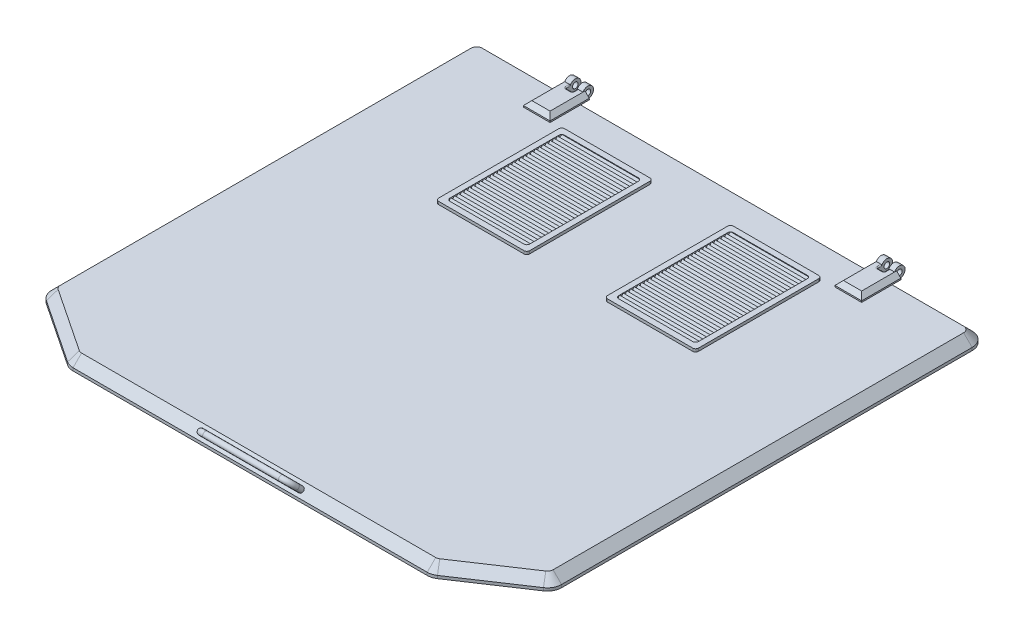
from build123d import *

# Parameters (mm, degrees)
BOSS_EXTRUDE1_DEPTH      = 30
CHAMFER1_SIZE            = 10
BOSS_EXTRUDE3_DEPTH      = 40
CHAMFER3_SIZE            = 30
SKETCH5_W                = 94.289642791
SKETCH5_H                = 138.3581249
BOSS_EXTRUDE4_DEPTH      = 20
CHAMFER4_SIZE            = 15
CHAMFER5_SIZE            = 15
SURFACE_EXTRUDE1_1_BACK  = 20
SURFACE_EXTRUDE1_1_DEPTH = 20
THICKEN1_T2              = 10
SURFACE_EXTRUDE2_2_BACK  = 20
SURFACE_EXTRUDE2_2_DEPTH = 20
THICKEN2_T2              = 10
SURFACE_EXTRUDE4_3_DEPTH = 20
THICKEN3_T2              = 10
SURFACE_EXTRUDE3_4_BACK  = 20
SURFACE_EXTRUDE3_4_DEPTH = 20
THICKEN4_T2              = 10
BOSS_EXTRUDE5_DEPTH      = 10
CUT_EXTRUDE3_DEPTH       = 60
CUT_EXTRUDE3_DEPTH_BACK  = 120
BOSS_EXTRUDE6_DEPTH      = 281.415480135
BOSS_EXTRUDE7_START      = -596.172988
BOSS_EXTRUDE7_DEPTH      = 281.415480135
SKETCH17_R               = 10
SKETCH24_W               = 24.289642791
SKETCH24_H               = 20
CUT_EXTRUDE11_DEPTH      = 25
FILLET4_R                = 4


with BuildPart() as part:
    # Sketch1 → Boss-Extrude1 (new body)
    with BuildSketch(Plane(origin=(0, 0, 0), x_dir=(1, 0, 0), z_dir=(0, 1, 0))):
        with BuildLine():
            Line((-1250.346420529, 795.394052981), (-1250.346420529, -623.902271849))
            ThreePointArc((-1250.346420529, -623.902271849), (-1247.979912504, -633.33943036), (-1241.440424453, -640.543277736))
            Line((-1241.440424453, -640.543277736), (-1030.731332227, -781.016005887))
            ThreePointArc((-1030.731332227, -781.016005887), (-1025.433011277, -783.51684053), (-1019.637328303, -784.375))
            Line((-1019.637328303, -784.375), (218.944487245, -784.375))
            ThreePointArc((218.944487245, -784.375), (224.740170219, -783.51684053), (230.03849117, -781.016005887))
            Line((230.03849117, -781.016005887), (440.747583396, -640.543277736))
            ThreePointArc((440.747583396, -640.543277736), (447.287071447, -633.33943036), (449.653579471, -623.902271849))
            Line((449.653579471, -623.902271849), (449.653579471, 795.394052981))
            ThreePointArc((449.653579471, 795.394052981), (443.795715095, 809.536188605), (429.653579471, 815.394052981))
            Line((429.653579471, 815.394052981), (-1230.346420529, 815.394052981))
            ThreePointArc((-1230.346420529, 815.394052981), (-1244.488556153, 809.536188605), (-1250.346420529, 795.394052981))
        make_face()
    extrude(amount=BOSS_EXTRUDE1_DEPTH)

    # Chamfer1
    chamfer1_edges = [part.edges().sort_by_distance(p)[0] for p in [
        (-1250.346420529, 0, -85.745890566),
        (-1247.979912504, 0, 633.33943036),
        (-1136.08587834, 0, 710.779641811),
        (-1025.433011277, 0, 783.51684053),
        (-400.346420529, 0, 784.375),
        (224.740170219, 0, 783.51684053),
        (335.393037283, 0, 710.779641811),
        (447.287071447, 0, 633.33943036),
        (449.653579471, 0, -85.745890566),
        (443.795715095, 0, -809.536188605),
        (-400.346420529, 0, -815.394052981),
        (-1244.488556153, 0, -809.536188605),
    ]]
    chamfer(chamfer1_edges, length=CHAMFER1_SIZE)

    # Sketch4 → Boss-Extrude3 (add)
    with BuildSketch(Plane(origin=(0, 30, 0), x_dir=(1, 0, 0), z_dir=(0, 1, 0))):
        with BuildLine():
            Line((-1300.346420529, 815.394052981), (-1300.346420529, -634.605947019))
            ThreePointArc((-1300.346420529, -634.605947019), (-1294.430150467, -658.198843296), (-1278.08143034, -676.208461736))
            Line((-1278.08143034, -676.208461736), (-1053.427850869, -825.977514717))
            ThreePointArc((-1053.427850869, -825.977514717), (-1040.182048492, -832.229601324), (-1025.692841058, -834.375))
            Line((-1025.692841058, -834.375), (225, -834.375))
            ThreePointArc((225, -834.375), (239.489207434, -832.229601324), (252.735009811, -825.977514717))
            Line((252.735009811, -825.977514717), (477.388589282, -676.208461736))
            ThreePointArc((477.388589282, -676.208461736), (493.73730941, -658.198843296), (499.653579471, -634.605947019))
            Line((499.653579471, -634.605947019), (499.653579471, 815.394052981))
            ThreePointArc((499.653579471, 815.394052981), (485.008918531, 850.74939204), (449.653579471, 865.394052981))
            Line((449.653579471, 865.394052981), (-1250.346420529, 865.394052981))
            ThreePointArc((-1250.346420529, 865.394052981), (-1285.701759588, 850.74939204), (-1300.346420529, 815.394052981))
        make_face()
    extrude(amount=BOSS_EXTRUDE3_DEPTH)

    # Chamfer3
    chamfer3_edges = [part.edges().sort_by_distance(p)[0] for p in [
        (485.008918531, 70, -850.74939204),
        (-400.346420529, 70, -865.394052981),
        (-1285.701759588, 70, -850.74939204),
        (-1300.346420529, 70, -90.394052981),
        (-1294.430150467, 70, 658.198843296),
        (-1165.754640604, 70, 751.092988226),
        (-1040.182048492, 70, 832.229601324),
        (-400.346420529, 70, 834.375),
        (239.489207434, 70, 832.229601324),
        (365.061799547, 70, 751.092988226),
        (493.73730941, 70, 658.198843296),
        (499.653579471, 70, -90.394052981),
    ]]
    chamfer(chamfer3_edges, length=CHAMFER3_SIZE)

    # Sketch5 → Boss-Extrude4 (add)
    with BuildSketch(Plane(origin=(0, 70, 0), x_dir=(1, 0, 0), z_dir=(0, 1, 0))):
        with Locations((-950.476486909, 796.991485415)):
            Rectangle(SKETCH5_W, SKETCH5_H)
        with Locations((149.783645851, 796.991485415)):
            Rectangle(SKETCH5_W, SKETCH5_H)
    extrude(amount=BOSS_EXTRUDE4_DEPTH)

    # Chamfer4
    chamfer4_edges = [part.edges().sort_by_distance(p)[0] for p in [
        (196.928467246, 90, -796.991485415),
        (102.638824455, 90, -796.991485415),
        (149.783645851, 90, -727.812422965),
    ]]
    chamfer(chamfer4_edges, length=CHAMFER4_SIZE)

    # Chamfer5
    chamfer5_edges = [part.edges().sort_by_distance(p)[0] for p in [
        (-997.621308304, 90, -796.991485415),
        (-950.476486908, 90, -727.812422965),
        (-903.331665513, 90, -796.991485415),
    ]]
    chamfer(chamfer5_edges, length=CHAMFER5_SIZE)

    # Surface-Extrude1: a surface, the sketch's curves swept straight by 20 mm
    with BuildLine(Plane(origin=(181.928467246, 90, -866.170547865), x_dir=(0, 0, -1), z_dir=(1, 0, 0)).offset(-SURFACE_EXTRUDE1_1_BACK), mode=Mode.PRIVATE) as surface_extrude1_1_path:
        CenterArc((10, -10), 10, 0, 360)
    surface_extrude1_1 = Shell.extrude(surface_extrude1_1_path.wire(), (1 * SURFACE_EXTRUDE1_1_DEPTH, 0 * SURFACE_EXTRUDE1_1_DEPTH, 0 * SURFACE_EXTRUDE1_1_DEPTH))
    add(Solid.thicken(surface_extrude1_1, -THICKEN1_T2))

    # Surface-Extrude2: a surface, the sketch's curves swept straight by 20 mm
    with BuildLine(Plane(origin=(117.638824455, 90, -866.170547865), x_dir=(0, 0, 1), z_dir=(-1, 0, 0)).offset(-SURFACE_EXTRUDE2_2_BACK), mode=Mode.PRIVATE) as surface_extrude2_2_path:
        CenterArc((-10, -10), 10, 0, 360)
    surface_extrude2_2 = Shell.extrude(surface_extrude2_2_path.wire(), (-1 * SURFACE_EXTRUDE2_2_DEPTH, 0 * SURFACE_EXTRUDE2_2_DEPTH, 0 * SURFACE_EXTRUDE2_2_DEPTH))
    add(Solid.thicken(surface_extrude2_2, -THICKEN2_T2))

    # Surface-Extrude4: a surface, the sketch's curves swept straight by 20 mm
    with BuildLine(Plane(origin=(-918.331665513, 90, -866.170547865), x_dir=(0, 0, 1), z_dir=(-1, 0, 0)), mode=Mode.PRIVATE) as surface_extrude4_3_path:
        CenterArc((-10, -10), 10, 0, 360)
    surface_extrude4_3 = Shell.extrude(surface_extrude4_3_path.wire(), (-1 * SURFACE_EXTRUDE4_3_DEPTH, 0 * SURFACE_EXTRUDE4_3_DEPTH, 0 * SURFACE_EXTRUDE4_3_DEPTH))
    add(Solid.thicken(surface_extrude4_3, -THICKEN3_T2))

    # Surface-Extrude3: a surface, the sketch's curves swept straight by 20 mm
    with BuildLine(Plane(origin=(-982.621308304, 90, -866.170547865), x_dir=(0, 0, 1), z_dir=(-1, 0, 0)).offset(-SURFACE_EXTRUDE3_4_BACK), mode=Mode.PRIVATE) as surface_extrude3_4_path:
        CenterArc((-10, -10), 10, 0, 360)
    surface_extrude3_4 = Shell.extrude(surface_extrude3_4_path.wire(), (-1 * SURFACE_EXTRUDE3_4_DEPTH, 0 * SURFACE_EXTRUDE3_4_DEPTH, 0 * SURFACE_EXTRUDE3_4_DEPTH))
    add(Solid.thicken(surface_extrude3_4, -THICKEN4_T2))

    # Sketch11 → Boss-Extrude5 (add)
    with BuildSketch(Plane(origin=(0, 70, 0), x_dir=(1, 0, 0), z_dir=(0, 1, 0))):
        with BuildLine():
            Line((-849.140654716, 724.698495171), (-547.725174581, 724.698495171))
            ThreePointArc((-547.725174581, 724.698495171), (-540.654106769, 721.769562983), (-537.725174581, 714.698495171))
            Line((-537.725174581, 714.698495171), (-537.725174581, 289.990411642))
            ThreePointArc((-537.725174581, 289.990411642), (-540.654106769, 282.91934383), (-547.725174581, 279.990411642))
            Line((-547.725174581, 279.990411642), (-849.140654716, 279.990411642))
            ThreePointArc((-849.140654716, 279.990411642), (-856.211722528, 282.91934383), (-859.140654716, 289.990411642))
            Line((-859.140654716, 289.990411642), (-859.140654716, 714.698495171))
            ThreePointArc((-859.140654716, 714.698495171), (-856.211722528, 721.769562983), (-849.140654716, 724.698495171))
        make_face()
        with BuildLine():
            Line((48.447813659, 279.990411642), (-252.967666476, 279.990411642))
            ThreePointArc((-252.967666476, 279.990411642), (-260.038734288, 282.91934383), (-262.967666476, 289.990411642))
            Line((-262.967666476, 289.990411642), (-262.967666476, 714.698495171))
            ThreePointArc((-262.967666476, 714.698495171), (-260.038734288, 721.769562983), (-252.967666476, 724.698495171))
            Line((-252.967666476, 724.698495171), (48.447813659, 724.698495171))
            ThreePointArc((48.447813659, 724.698495171), (55.518881471, 721.769562983), (58.447813659, 714.698495171))
            Line((58.447813659, 714.698495171), (58.447813659, 289.990411642))
            ThreePointArc((58.447813659, 289.990411642), (55.518881471, 282.91934383), (48.447813659, 279.990411642))
        make_face()
    extrude(amount=BOSS_EXTRUDE5_DEPTH)

    # Sketch13 → Cut-Extrude3 (cut, two sides: drawn at the far end of the back side and taken through both)
    with BuildSketch(Plane(origin=(0, 70, 0), x_dir=(1, 0, 0), z_dir=(0, 1, 0)).offset(-CUT_EXTRUDE3_DEPTH_BACK)):
        with BuildLine():
            Line((-829.140654716, 704.698495171), (-567.725174581, 704.698495171))
            ThreePointArc((-567.725174581, 704.698495171), (-560.654106769, 701.769562983), (-557.725174581, 694.698495171))
            Line((-557.725174581, 694.698495171), (-557.725174581, 309.990411642))
            ThreePointArc((-557.725174581, 309.990411642), (-560.654106769, 302.91934383), (-567.725174581, 299.990411642))
            Line((-567.725174581, 299.990411642), (-829.140654716, 299.990411642))
            ThreePointArc((-829.140654716, 299.990411642), (-836.211722528, 302.91934383), (-839.140654716, 309.990411642))
            Line((-839.140654716, 309.990411642), (-839.140654716, 694.698495171))
            ThreePointArc((-839.140654716, 694.698495171), (-836.211722528, 701.769562983), (-829.140654716, 704.698495171))
        make_face()
        with BuildLine():
            Line((-242.967666476, 694.698495171), (-242.967666476, 309.990411642))
            ThreePointArc((-242.967666476, 309.990411642), (-240.038734288, 302.91934383), (-232.967666476, 299.990411642))
            Line((-232.967666476, 299.990411642), (28.447813659, 299.990411642))
            ThreePointArc((28.447813659, 299.990411642), (35.518881471, 302.91934383), (38.447813659, 309.990411642))
            Line((38.447813659, 309.990411642), (38.447813659, 694.698495171))
            ThreePointArc((38.447813659, 694.698495171), (35.518881471, 701.769562983), (28.447813659, 704.698495171))
            Line((28.447813659, 704.698495171), (-232.967666476, 704.698495171))
            ThreePointArc((-232.967666476, 704.698495171), (-240.038734288, 701.769562983), (-242.967666476, 694.698495171))
        make_face()
    extrude(amount=CUT_EXTRUDE3_DEPTH + CUT_EXTRUDE3_DEPTH_BACK, mode=Mode.SUBTRACT)

    # Sketch15 → Boss-Extrude6 (add)
    with BuildSketch(Plane.ZY.offset(557.725174581)):
        Polygon((-299.496230991, 80), (-304.061960858, 70), (-295.099602231, 57.127501154), (-290.533872364, 67.127501154), align=None)
        Polygon((-312.496230991, 80), (-317.061960858, 70), (-308.099602231, 57.127501154), (-303.533872364, 67.127501154), align=None)
        Polygon((-325.496230991, 80), (-330.061960858, 70), (-321.099602231, 57.127501154), (-316.533872364, 67.127501154), align=None)
        Polygon((-338.496230991, 80), (-343.061960858, 70), (-334.099602231, 57.127501154), (-329.533872364, 67.127501154), align=None)
        Polygon((-351.496230991, 80), (-356.061960858, 70), (-347.099602231, 57.127501154), (-342.533872364, 67.127501154), align=None)
        Polygon((-364.496230991, 80), (-369.061960858, 70), (-360.099602231, 57.127501154), (-355.533872364, 67.127501154), align=None)
        Polygon((-377.496230991, 80), (-382.061960858, 70), (-373.099602231, 57.127501154), (-368.533872364, 67.127501154), align=None)
        Polygon((-390.496230991, 80), (-395.061960858, 70), (-386.099602231, 57.127501154), (-381.533872364, 67.127501154), align=None)
        Polygon((-403.496230991, 80), (-408.061960858, 70), (-399.099602231, 57.127501154), (-394.533872364, 67.127501154), align=None)
        Polygon((-416.496230991, 80), (-421.061960858, 70), (-412.099602231, 57.127501154), (-407.533872364, 67.127501154), align=None)
        Polygon((-429.496230991, 80), (-434.061960858, 70), (-425.099602231, 57.127501154), (-420.533872364, 67.127501154), align=None)
        Polygon((-442.496230991, 80), (-447.061960858, 70), (-438.099602231, 57.127501154), (-433.533872364, 67.127501154), align=None)
        Polygon((-455.496230991, 80), (-460.061960858, 70), (-451.099602231, 57.127501154), (-446.533872364, 67.127501154), align=None)
        Polygon((-468.496230991, 80), (-473.061960858, 70), (-464.099602231, 57.127501154), (-459.533872364, 67.127501154), align=None)
        Polygon((-481.496230991, 80), (-486.061960858, 70), (-477.099602231, 57.127501154), (-472.533872364, 67.127501154), align=None)
        Polygon((-494.496230991, 80), (-499.061960858, 70), (-490.099602231, 57.127501154), (-485.533872364, 67.127501154), align=None)
        Polygon((-507.496230991, 80), (-512.061960858, 70), (-503.099602231, 57.127501154), (-498.533872364, 67.127501154), align=None)
        Polygon((-520.496230991, 80), (-525.061960858, 70), (-516.099602231, 57.127501154), (-511.533872364, 67.127501154), align=None)
        Polygon((-533.496230991, 80), (-538.061960858, 70), (-529.099602231, 57.127501154), (-524.533872364, 67.127501154), align=None)
        Polygon((-546.496230991, 80), (-551.061960858, 70), (-542.099602231, 57.127501154), (-537.533872364, 67.127501154), align=None)
        Polygon((-559.496230991, 80), (-564.061960858, 70), (-555.099602231, 57.127501154), (-550.533872364, 67.127501154), align=None)
        Polygon((-572.496230991, 80), (-577.061960858, 70), (-568.099602231, 57.127501154), (-563.533872364, 67.127501154), align=None)
        Polygon((-585.496230991, 80), (-590.061960858, 70), (-581.099602231, 57.127501154), (-576.533872364, 67.127501154), align=None)
        Polygon((-598.496230991, 80), (-603.061960858, 70), (-594.099602231, 57.127501154), (-589.533872364, 67.127501154), align=None)
        Polygon((-611.496230991, 80), (-616.061960858, 70), (-607.099602231, 57.127501154), (-602.533872364, 67.127501154), align=None)
        Polygon((-624.496230991, 80), (-629.061960858, 70), (-620.099602231, 57.127501154), (-615.533872364, 67.127501154), align=None)
        Polygon((-637.496230991, 80), (-642.061960858, 70), (-633.099602231, 57.127501154), (-628.533872364, 67.127501154), align=None)
        Polygon((-650.496230991, 80), (-655.061960858, 70), (-646.099602231, 57.127501154), (-641.533872364, 67.127501154), align=None)
        Polygon((-663.496230991, 80), (-668.061960858, 70), (-659.099602231, 57.127501154), (-654.533872364, 67.127501154), align=None)
        Polygon((-676.496230991, 80), (-681.061960858, 70), (-672.099602231, 57.127501154), (-667.533872364, 67.127501154), align=None)
        Polygon((-689.496230991, 80), (-694.061960858, 70), (-685.099602231, 57.127501154), (-680.533872364, 67.127501154), align=None)
        Polygon((-702.496230991, 80), (-707.061960858, 70), (-698.099602231, 57.127501154), (-693.533872364, 67.127501154), align=None)
    extrude(amount=BOSS_EXTRUDE6_DEPTH)

    # Sketch15<2> → Boss-Extrude7 (add)
    with BuildSketch(Plane.ZY.offset(557.725174581).offset(BOSS_EXTRUDE7_START)):
        Polygon((-299.496230991, 80), (-304.061960858, 70), (-295.099602231, 57.127501154), (-290.533872364, 67.127501154), align=None)
        Polygon((-312.496230991, 80), (-317.061960858, 70), (-308.099602231, 57.127501154), (-303.533872364, 67.127501154), align=None)
        Polygon((-325.496230991, 80), (-330.061960858, 70), (-321.099602231, 57.127501154), (-316.533872364, 67.127501154), align=None)
        Polygon((-338.496230991, 80), (-343.061960858, 70), (-334.099602231, 57.127501154), (-329.533872364, 67.127501154), align=None)
        Polygon((-351.496230991, 80), (-356.061960858, 70), (-347.099602231, 57.127501154), (-342.533872364, 67.127501154), align=None)
        Polygon((-364.496230991, 80), (-369.061960858, 70), (-360.099602231, 57.127501154), (-355.533872364, 67.127501154), align=None)
        Polygon((-377.496230991, 80), (-382.061960858, 70), (-373.099602231, 57.127501154), (-368.533872364, 67.127501154), align=None)
        Polygon((-390.496230991, 80), (-395.061960858, 70), (-386.099602231, 57.127501154), (-381.533872364, 67.127501154), align=None)
        Polygon((-403.496230991, 80), (-408.061960858, 70), (-399.099602231, 57.127501154), (-394.533872364, 67.127501154), align=None)
        Polygon((-416.496230991, 80), (-421.061960858, 70), (-412.099602231, 57.127501154), (-407.533872364, 67.127501154), align=None)
        Polygon((-429.496230991, 80), (-434.061960858, 70), (-425.099602231, 57.127501154), (-420.533872364, 67.127501154), align=None)
        Polygon((-442.496230991, 80), (-447.061960858, 70), (-438.099602231, 57.127501154), (-433.533872364, 67.127501154), align=None)
        Polygon((-455.496230991, 80), (-460.061960858, 70), (-451.099602231, 57.127501154), (-446.533872364, 67.127501154), align=None)
        Polygon((-468.496230991, 80), (-473.061960858, 70), (-464.099602231, 57.127501154), (-459.533872364, 67.127501154), align=None)
        Polygon((-481.496230991, 80), (-486.061960858, 70), (-477.099602231, 57.127501154), (-472.533872364, 67.127501154), align=None)
        Polygon((-494.496230991, 80), (-499.061960858, 70), (-490.099602231, 57.127501154), (-485.533872364, 67.127501154), align=None)
        Polygon((-507.496230991, 80), (-512.061960858, 70), (-503.099602231, 57.127501154), (-498.533872364, 67.127501154), align=None)
        Polygon((-520.496230991, 80), (-525.061960858, 70), (-516.099602231, 57.127501154), (-511.533872364, 67.127501154), align=None)
        Polygon((-533.496230991, 80), (-538.061960858, 70), (-529.099602231, 57.127501154), (-524.533872364, 67.127501154), align=None)
        Polygon((-546.496230991, 80), (-551.061960858, 70), (-542.099602231, 57.127501154), (-537.533872364, 67.127501154), align=None)
        Polygon((-559.496230991, 80), (-564.061960858, 70), (-555.099602231, 57.127501154), (-550.533872364, 67.127501154), align=None)
        Polygon((-572.496230991, 80), (-577.061960858, 70), (-568.099602231, 57.127501154), (-563.533872364, 67.127501154), align=None)
        Polygon((-585.496230991, 80), (-590.061960858, 70), (-581.099602231, 57.127501154), (-576.533872364, 67.127501154), align=None)
        Polygon((-598.496230991, 80), (-603.061960858, 70), (-594.099602231, 57.127501154), (-589.533872364, 67.127501154), align=None)
        Polygon((-611.496230991, 80), (-616.061960858, 70), (-607.099602231, 57.127501154), (-602.533872364, 67.127501154), align=None)
        Polygon((-624.496230991, 80), (-629.061960858, 70), (-620.099602231, 57.127501154), (-615.533872364, 67.127501154), align=None)
        Polygon((-637.496230991, 80), (-642.061960858, 70), (-633.099602231, 57.127501154), (-628.533872364, 67.127501154), align=None)
        Polygon((-650.496230991, 80), (-655.061960858, 70), (-646.099602231, 57.127501154), (-641.533872364, 67.127501154), align=None)
        Polygon((-663.496230991, 80), (-668.061960858, 70), (-659.099602231, 57.127501154), (-654.533872364, 67.127501154), align=None)
        Polygon((-676.496230991, 80), (-681.061960858, 70), (-672.099602231, 57.127501154), (-667.533872364, 67.127501154), align=None)
        Polygon((-689.496230991, 80), (-694.061960858, 70), (-685.099602231, 57.127501154), (-680.533872364, 67.127501154), align=None)
        Polygon((-702.496230991, 80), (-707.061960858, 70), (-698.099602231, 57.127501154), (-693.533872364, 67.127501154), align=None)
    extrude(amount=BOSS_EXTRUDE7_DEPTH)

    # Sweep1: sweep along a path in Sketch16
    with BuildLine(Plane(origin=(0, -382.1875, 382.1875), x_dir=(1, 0, 0), z_dir=(0, 0.707106781186549, -0.7071067811865461))) as sweep1_path:
        Line((-564.259166525, -618.2764918), (-564.259166525, -643.0344403))
        ThreePointArc((-564.259166525, -643.0344403), (-555.472369961, -664.247643736), (-534.259166525, -673.0344403))
        Line((-534.259166525, -673.0344403), (-266.433674532, -673.0344403))
        ThreePointArc((-266.433674532, -673.0344403), (-245.220471097, -664.247643736), (-236.433674532, -643.0344403))
        Line((-236.433674532, -643.0344403), (-236.433674532, -618.2764918))
    # Sketch17 → Sweep1 (sweep)
    with BuildSketch(Plane(origin=(0, 437.1875, 437.1875), x_dir=(1, 0, 0), z_dir=(0, 0.7071067811865461, 0.707106781186549))):
        with Locations((-564.259166525, -540.494745869)):
            Circle(SKETCH17_R)
    sweep(path=sweep1_path.line)

    # Sketch24 → Cut-Extrude11 (cut)
    with BuildSketch(Plane(origin=(0, 0, -866.170547865), x_dir=(-1, 0, 0), z_dir=(0, 0, -1))):
        with Locations((-149.783645851, 80)):
            Rectangle(SKETCH24_W, SKETCH24_H)
        with Locations((950.476486909, 80)):
            Rectangle(SKETCH24_W, SKETCH24_H)
    extrude(amount=-CUT_EXTRUDE11_DEPTH, mode=Mode.SUBTRACT)

    # Fillet4
    fillet4_edges = [part.edges().sort_by_distance(p)[0] for p in [
        (161.928467246, 80, -841.170547865),
        (161.928467246, 70, -850.010293827),
        (149.783645851, 90, -841.170547865),
        (161.928467246, 90, -850.010293827),
        (137.638824455, 80, -841.170547865),
        (137.638824455, 90, -850.010293827),
        (149.783645851, 70, -841.170547865),
        (137.638824455, 70, -850.010293827),
        (-938.331665513, 80, -841.170547865),
        (-938.331665513, 70, -850.010293827),
        (-950.476486908, 90, -841.170547865),
        (-938.331665513, 90, -850.010293827),
        (-962.621308304, 80, -841.170547865),
        (-962.621308304, 90, -850.010293827),
        (-950.476486908, 70, -841.170547865),
        (-962.621308304, 70, -850.010293827),
    ]]
    fillet(fillet4_edges, radius=FILLET4_R)


solid = part.part
